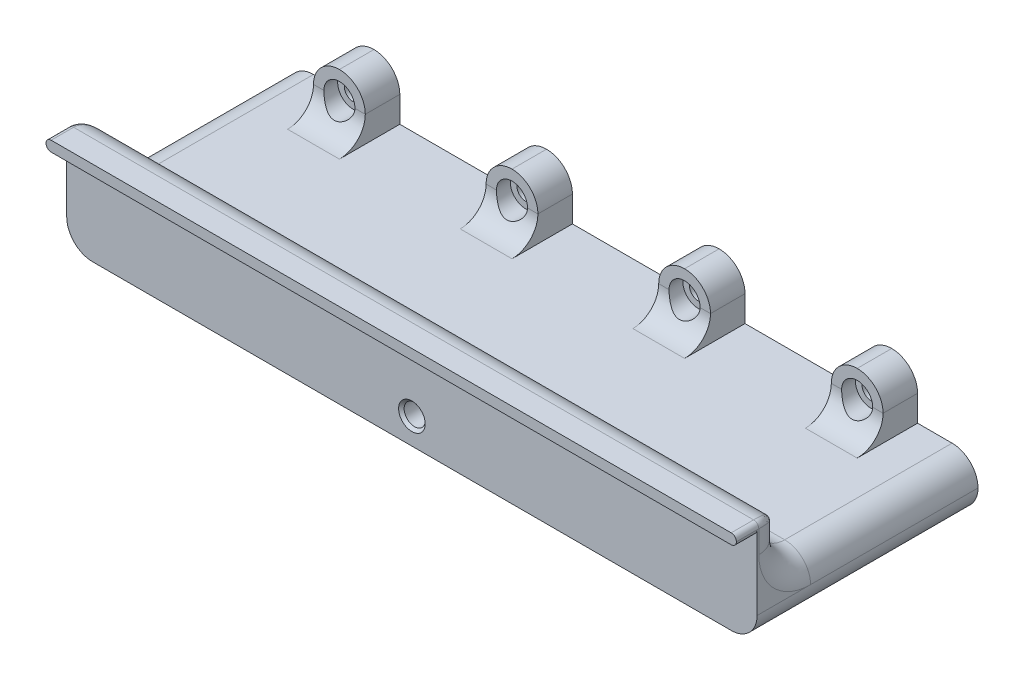
from build123d import *

# Parameters (mm, degrees)
SKETCH1_W             = 15
SKETCH1_H             = 15
SKETCH1_R             = 2.6
BOSS_EXTRUDE1_DEPTH   = 6
BOSS_EXTRUDE1_2_DEPTH = 6
BOSS_EXTRUDE1_3_DEPTH = 6
BOSS_EXTRUDE1_4_DEPTH = 6
BOSS_EXTRUDE2_DEPTH   = 64
SKETCH2_R             = 3.05
CUT_EXTRUDE1_DEPTH    = 8
SKETCH3_W             = 15
SKETCH3_H             = 15
SKETCH3_R             = 4.5
BOSS_EXTRUDE3_DEPTH   = 4
CHAMFER1_SIZE         = 0.8
SKETCH4_W             = 200
SKETCH4_H             = 8
BOSS_EXTRUDE4_DEPTH   = 15.5
SKETCH5_W             = 200
SKETCH5_H             = 3
BOSS_EXTRUDE5_DEPTH   = 6
FILLET3_R             = 7.5
FILLET4_R             = 1.5


# Some blends are built 0.0001 mm under size
with BuildPart() as part:
    # Sketch1 → Boss-Extrude1 (new body)
    with BuildSketch(Plane.XY):
        with Locations((-25, 15)):
            Rectangle(SKETCH1_W, SKETCH1_H)
        with Locations((-25, 15)):
            Circle(SKETCH1_R, mode=Mode.SUBTRACT)
    extrude(amount=BOSS_EXTRUDE1_DEPTH)



with BuildPart() as body_2:
    # Sketch1 → Boss-Extrude1 2 (new body)
    with BuildSketch(Plane.XY):
        with Locations((25, 15)):
            Rectangle(SKETCH1_W, SKETCH1_H)
        with Locations((25, 15)):
            Circle(SKETCH1_R, mode=Mode.SUBTRACT)
    extrude(amount=BOSS_EXTRUDE1_2_DEPTH)


with BuildPart() as body_3:
    # Sketch1 → Boss-Extrude1 3 (new body)
    with BuildSketch(Plane.XY):
        with Locations((-75, 15)):
            Rectangle(SKETCH1_W, SKETCH1_H)
        with Locations((-75, 15)):
            Circle(SKETCH1_R, mode=Mode.SUBTRACT)
    extrude(amount=BOSS_EXTRUDE1_3_DEPTH)


with BuildPart() as body_4:
    # Sketch1 → Boss-Extrude1 4 (new body)
    with BuildSketch(Plane.XY):
        with Locations((75, 15)):
            Rectangle(SKETCH1_W, SKETCH1_H)
        with Locations((75, 15)):
            Circle(SKETCH1_R, mode=Mode.SUBTRACT)
    extrude(amount=BOSS_EXTRUDE1_4_DEPTH)


with BuildPart() as part_1:
    add(part.part)

    add(body_2.part)  # Boss-Extrude2 merges body 2

    add(body_3.part)  # Boss-Extrude2 merges body 3
    # Sketch1<4> → Boss-Extrude2 (add)
    with BuildSketch(Plane.XY):
        Polygon((-100, 7.5), (-100, -7.5), (100, -7.5), (100, 7.5), (82.5, 7.5), (67.5, 7.5), (32.5, 7.5), (17.5, 7.5), (-17.5, 7.5), (-32.5, 7.5), (-67.5, 7.5), (-82.5, 7.5), align=None)
    extrude(amount=BOSS_EXTRUDE2_DEPTH)

    # Sketch2 → Cut-Extrude1 (cut)
    with BuildSketch(Plane.XY.offset(64)):
        Circle(SKETCH2_R)
    extrude(amount=-CUT_EXTRUDE1_DEPTH, mode=Mode.SUBTRACT)


    add(body_4.part)  # Boss-Extrude3 merges body 4
    # Sketch3 → Boss-Extrude3 (add)
    # profile 1 of 4: a face of its own
    with BuildSketch(Plane.XY.offset(6)):
        with Locations((75, 15)):
            Rectangle(SKETCH3_W, SKETCH3_H)
        with Locations((75, 15)):
            Circle(SKETCH3_R, mode=Mode.SUBTRACT)
    # profile 2 of 4: a face of its own
    with BuildSketch(Plane.XY.offset(6)):
        with Locations((25, 15)):
            Rectangle(SKETCH3_W, SKETCH3_H)
        with Locations((25, 15)):
            Circle(SKETCH3_R, mode=Mode.SUBTRACT)
    # profile 3 of 4: a face of its own
    with BuildSketch(Plane.XY.offset(6)):
        with Locations((-25, 15)):
            Rectangle(SKETCH3_W, SKETCH3_H)
        with Locations((-25, 15)):
            Circle(SKETCH3_R, mode=Mode.SUBTRACT)
    # profile 4 of 4: a face of its own
    with BuildSketch(Plane.XY.offset(6)):
        with Locations((-75, 15)):
            Rectangle(SKETCH3_W, SKETCH3_H)
        with Locations((-75, 15)):
            Circle(SKETCH3_R, mode=Mode.SUBTRACT)
    extrude(amount=BOSS_EXTRUDE3_DEPTH)

    # Chamfer1
    chamfer1_edges = [part_1.edges().sort_by_distance(p)[0] for p in [
        (-3.05, 0, 64),
    ]]
    chamfer(chamfer1_edges, length=CHAMFER1_SIZE)

    # Sketch4 → Boss-Extrude4 (add)
    with BuildSketch(Plane(origin=(0, 7.5, 0), x_dir=(1, 0, 0), z_dir=(0, 1, 0))):
        with Locations((0, -60)):
            Rectangle(SKETCH4_W, SKETCH4_H)
    extrude(amount=BOSS_EXTRUDE4_DEPTH)

    # Sketch5 → Boss-Extrude5 (add)
    with BuildSketch(Plane.XY.offset(64)):
        with Locations((0, 21.5)):
            Rectangle(SKETCH5_W, SKETCH5_H)
    extrude(amount=BOSS_EXTRUDE5_DEPTH)

    # Fillet3
    # the kernel refuses this fillet: 7.5 mm, written as the material it adds along each edge
    with BuildSketch(Plane(origin=(-82.5, 7.5, 10), x_dir=(0, 1, 0), z_dir=(1, 0, 0))) as fillet3_piece_1_section:
        with BuildLine():
            CenterArc((FILLET3_R, FILLET3_R), FILLET3_R, 180, 90)
            Line((0, FILLET3_R), (0, 0))
            Line((0, 0), (FILLET3_R, 0))
        make_face()
    fillet3_piece_1 = extrude(amount=15, mode=Mode.PRIVATE)
    fillet3_piece_1 = fillet3_piece_1 - Plane(origin=(-75, 15, 10), x_dir=(1, 0, 0), z_dir=(0, 0, -1)) * Cylinder(4.5, 60, mode=Mode.PRIVATE)
    add(fillet3_piece_1)
    with BuildSketch(Plane(origin=(-32.5, 7.5, 10), x_dir=(0, 1, 0), z_dir=(1, 0, 0))) as fillet3_piece_2_section:
        with BuildLine():
            CenterArc((FILLET3_R, FILLET3_R), FILLET3_R, 180, 90)
            Line((0, FILLET3_R), (0, 0))
            Line((0, 0), (FILLET3_R, 0))
        make_face()
    fillet3_piece_2 = extrude(amount=15, mode=Mode.PRIVATE)
    fillet3_piece_2 = fillet3_piece_2 - Plane(origin=(-25, 15, 10), x_dir=(1, 0, 0), z_dir=(0, 0, -1)) * Cylinder(4.5, 61, mode=Mode.PRIVATE)
    add(fillet3_piece_2)
    with BuildSketch(Plane(origin=(17.5, 7.5, 10), x_dir=(0, 1, 0), z_dir=(1, 0, 0))) as fillet3_piece_3_section:
        with BuildLine():
            CenterArc((FILLET3_R, FILLET3_R), FILLET3_R, 180, 90)
            Line((0, FILLET3_R), (0, 0))
            Line((0, 0), (FILLET3_R, 0))
        make_face()
    fillet3_piece_3 = extrude(amount=15, mode=Mode.PRIVATE)
    fillet3_piece_3 = fillet3_piece_3 - Plane(origin=(25, 15, 10), x_dir=(1, 0, 0), z_dir=(0, 0, -1)) * Cylinder(4.5, 61, mode=Mode.PRIVATE)
    add(fillet3_piece_3)
    with BuildSketch(Plane(origin=(67.5, 7.5, 10), x_dir=(0, 1, 0), z_dir=(1, 0, 0))) as fillet3_piece_4_section:
        with BuildLine():
            CenterArc((FILLET3_R, FILLET3_R), FILLET3_R, 180, 90)
            Line((0, FILLET3_R), (0, 0))
            Line((0, 0), (FILLET3_R, 0))
        make_face()
    fillet3_piece_4 = extrude(amount=15, mode=Mode.PRIVATE)
    fillet3_piece_4 = fillet3_piece_4 - Plane(origin=(75, 15, 10), x_dir=(1, 0, 0), z_dir=(0, 0, -1)) * Cylinder(4.5, 60, mode=Mode.PRIVATE)
    add(fillet3_piece_4)
    with BuildSketch(Plane(origin=(100, 7.5, 56), x_dir=(0, 0, -1), z_dir=(-1, 0, 0))) as fillet3_piece_5:
        with BuildLine():
            CenterArc((FILLET3_R, -FILLET3_R), FILLET3_R, 90, 90)
            Line((0, -FILLET3_R), (0, 0))
            Line((0, 0), (FILLET3_R, 0))
        make_face()
    extrude(amount=200)
    # the kernel refuses this fillet: 7.5 mm, written as the material it takes off along each edge
    with BuildSketch(Plane(origin=(100, -7.5, -18.75), x_dir=(-1, 0, 0), z_dir=(0, 0, 1))) as fillet3_2_piece_1:
        with BuildLine():
            CenterArc((FILLET3_R, -FILLET3_R), FILLET3_R, 90, 90)
            Line((0, -FILLET3_R), (0, 0))
            Line((0, 0), (FILLET3_R, 0))
        make_face()
    extrude(amount=101.5, mode=Mode.SUBTRACT)
    with BuildSketch(Plane(origin=(-100, -7.5, -18.75), x_dir=(1, 0, 0), z_dir=(0, 0, 1))) as fillet3_2_piece_2:
        with BuildLine():
            CenterArc((FILLET3_R, FILLET3_R), FILLET3_R, 180, 90)
            Line((0, FILLET3_R), (0, 0))
            Line((0, 0), (FILLET3_R, 0))
        make_face()
    extrude(amount=101.5, mode=Mode.SUBTRACT)
    with BuildSketch(Plane(origin=(67.5, 22.5, 28.75), x_dir=(0, -1, 0), z_dir=(0, 0, -1)), Plane(origin=(-82.5, 22.5, 28.75), x_dir=(0, -1, 0), z_dir=(0, 0, -1)), Plane(origin=(17.5, 22.5, 28.75), x_dir=(0, -1, 0), z_dir=(0, 0, -1)), Plane(origin=(-32.5, 22.5, 28.75), x_dir=(0, -1, 0), z_dir=(0, 0, -1))) as fillet3_2_piece_3:
        with BuildLine():
            CenterArc((FILLET3_R, -FILLET3_R), FILLET3_R, 90, 90)
            Line((0, -FILLET3_R), (0, 0))
            Line((0, 0), (FILLET3_R, 0))
        make_face()
    extrude(amount=47.5, mode=Mode.SUBTRACT)
    with BuildSketch(Plane(origin=(-67.5, 22.5, -18.75), x_dir=(-1, 0, 0), z_dir=(0, 0, 1)), Plane(origin=(-17.5, 22.5, -18.75), x_dir=(-1, 0, 0), z_dir=(0, 0, 1)), Plane(origin=(32.5, 22.5, -18.75), x_dir=(-1, 0, 0), z_dir=(0, 0, 1)), Plane(origin=(82.5, 22.5, -18.75), x_dir=(-1, 0, 0), z_dir=(0, 0, 1))) as fillet3_2_piece_4:
        with BuildLine():
            CenterArc((FILLET3_R, FILLET3_R), FILLET3_R, 180, 90)
            Line((0, FILLET3_R), (0, 0))
            Line((0, 0), (FILLET3_R, 0))
        make_face()
    extrude(amount=47.5, mode=Mode.SUBTRACT)
    with BuildSketch(Plane(origin=(118.75, 23, 56), x_dir=(0, -1, 0), z_dir=(-1, 0, 0))) as fillet3_2_piece_5:
        with BuildLine():
            CenterArc((FILLET3_R, FILLET3_R), FILLET3_R, 180, 90)
            Line((0, FILLET3_R), (0, 0))
            Line((0, 0), (FILLET3_R, 0))
        make_face()
    extrude(amount=237.5, mode=Mode.SUBTRACT)
    # the kernel refuses this fillet: 7.5 mm, written as the material it takes off along each edge
    with BuildSketch(Plane(origin=(-100, 7.5, -18.75), x_dir=(0, -1, 0), z_dir=(0, 0, 1)), Plane(origin=(100, 7.5, -18.75), x_dir=(-1, 0, 0), z_dir=(0, 0, 1))) as fillet3_3_piece_1:
        with BuildLine():
            CenterArc((FILLET3_R, FILLET3_R), FILLET3_R, 180, 90)
            Line((0, FILLET3_R), (0, 0))
            Line((0, 0), (FILLET3_R, 0))
        make_face()
    extrude(amount=67.25, mode=Mode.SUBTRACT)
    with BuildSketch(Plane(origin=(100, 15, 56), x_dir=(-1, 0, 0), z_dir=(0, 1, 0)), Plane(origin=(-100, 15, 56), x_dir=(0, 0, 1), z_dir=(0, 1, 0))) as fillet3_3_piece_2:
        with BuildLine():
            CenterArc((FILLET3_R, FILLET3_R), FILLET3_R, 180, 90)
            Line((0, FILLET3_R), (0, 0))
            Line((0, 0), (FILLET3_R, 0))
        make_face()
    extrude(amount=19.25, mode=Mode.SUBTRACT)
    with BuildSketch(Plane(origin=(-100, 15, 48.5), x_dir=(0, -1, 0), z_dir=(0, 0, -1))) as fillet3_3_piece_3:
        with BuildLine():
            CenterArc((7.5 + FILLET3_R, -FILLET3_R), FILLET3_R, 90, 90)
            Line((7.5, -FILLET3_R), (7.5, 0))
            Line((7.5, 0), (7.5 + FILLET3_R, 0))
        make_face()
    revolve(axis=Axis((-100, 15, 48.5), (-1, 0, 0)), revolution_arc=90, mode=Mode.SUBTRACT)
    with BuildSketch(Plane(origin=(100, 15, 48.5), x_dir=(0, -1, 0), z_dir=(0, 0, -1))) as fillet3_3_piece_4:
        with BuildLine():
            CenterArc((7.5 + FILLET3_R, FILLET3_R), FILLET3_R, 180, 90)
            Line((7.5 + FILLET3_R, 0), (7.5, 0))
            Line((7.5, 0), (7.5, FILLET3_R))
        make_face()
    revolve(axis=Axis((100, 15, 48.5), (-1, 0, 0)), revolution_arc=90, mode=Mode.SUBTRACT)

    # Fillet4
    fillet4_edges = [part_1.edges().sort_by_distance(p)[0] for p in [
        (-97.803300859, 20.803300859, 58.196699141),
        (97.803300859, 20.803300859, 58.196699141),
        (-100, 20, 67),
        (-100, 23, 66.75),
        (100, 23, 66.75),
        (100, 20, 67),
    ]]
    fillet(fillet4_edges, radius=FILLET4_R - 0.0001)  # a hair under: the kernel refuses the full size


solid = part_1.part
